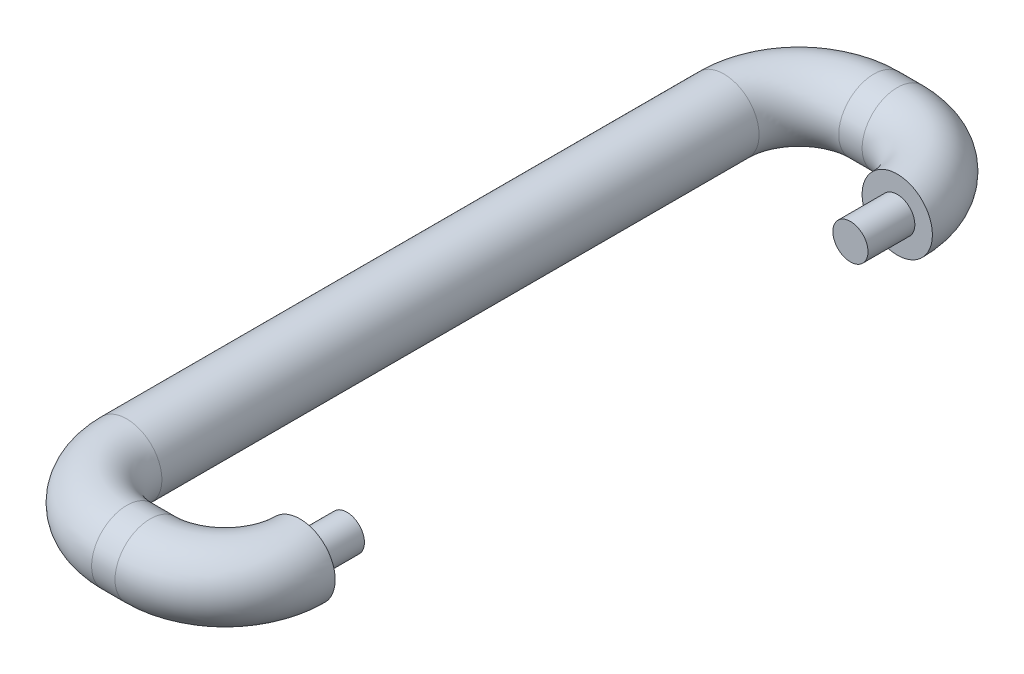
from build123d import *

# Parameters (mm, degrees)
SKETCH_2_R          = 7.5
EXTRUDE_1_DEPTH     = 127.5
SKETCH_3_R          = 7.5
REVOLVE_1_ANGLE     = 90
REVOLVE_2_OUTLINE_R = 7.5
REVOLVE_2_ANGLE     = 90
SKETCH_19_R         = 7.5
EXTRUDE_2_DEPTH     = 5
SKETCH_21_R         = 7.5
EXTRUDE_3_DEPTH     = 5
SKETCH_22_R         = 7.5
REVOLVE_3_ANGLE     = 90
SKETCH_23_R         = 7.5
REVOLVE_4_ANGLE     = 90
SKETCH_25_R         = 3.75
EXTRUDE_4_DEPTH     = 10
EXTRUDE_START       = 10
SKETCH_26_R         = 3.75
EXTRUDE_5_DEPTH     = 10


# Read off the part's stored shape, not the designer's step: Повернуть2
with BuildPart() as part:
    # Эскиз2 → Бобышка-Вытянуть1 (new body)
    with BuildSketch(Plane.XY):
        Circle(SKETCH_2_R)
    extrude(amount=EXTRUDE_1_DEPTH)

    # Эскиз3 → Повернуть1 (revolve)
    with BuildSketch(Plane.XY.offset(127.5)):
        with Locations(Location((0, 0, 0), (0, 0, 180))):
            Circle(SKETCH_3_R)
    revolve(axis=Axis((16, 0, 127.5), (0, 1, 0)), revolution_arc=REVOLVE_1_ANGLE)

    # Повернуть2 outline → Повернуть2 (revolve)
    with BuildSketch(Plane(origin=(16, 0, 0), x_dir=(0, 0, -1), z_dir=(1, 0, 0))):
        with Locations((16, 0)):
            Circle(REVOLVE_2_OUTLINE_R)
    revolve(axis=Axis((16, 0, 0), (0, 1, 0)), revolution_arc=REVOLVE_2_ANGLE)

    # Эскиз19 → Бобышка-Вытянуть2 (add)
    with BuildSketch(Plane(origin=(16, 0, 0), x_dir=(0, 0, -1), z_dir=(1, 0, 0))):
        with Locations((16, 0)):
            Circle(SKETCH_19_R)
    extrude(amount=EXTRUDE_2_DEPTH)

    # Эскиз21 → Бобышка-Вытянуть3 (add)
    with BuildSketch(Plane(origin=(16, 0, 0), x_dir=(0, 0, -1), z_dir=(1, 0, 0))):
        with Locations(Location((-143.5, 0, 0), (0, 0, 180))):
            Circle(SKETCH_21_R)
    extrude(amount=EXTRUDE_3_DEPTH)

    # Эскиз22 → Повернуть3 (revolve)
    with BuildSketch(Plane(origin=(21, 0, 0), x_dir=(0, 0, -1), z_dir=(1, 0, 0))):
        with Locations((16, 0)):
            Circle(SKETCH_22_R)
    revolve(axis=Axis((21, 0, 0), (0, -1, 0)), revolution_arc=REVOLVE_3_ANGLE)

    # Эскиз23 → Повернуть4 (revolve)
    with BuildSketch(Plane(origin=(21, 0, 0), x_dir=(0, 0, -1), z_dir=(1, 0, 0))):
        with Locations(Location((-143.5, 0, 0), (0, 0, 180))):
            Circle(SKETCH_23_R)
    revolve(axis=Axis((21, 0, 127.5), (0, 1, 0)), revolution_arc=REVOLVE_4_ANGLE)

    # Эскиз25 → Бобышка-Вытянуть4 (add)
    with BuildSketch(Plane.XY):
        with Locations((37, 0)):
            Circle(SKETCH_25_R)
    extrude(amount=EXTRUDE_4_DEPTH)

    # Эскиз26 → Бобышка-Вытянуть5 (add)
    with BuildSketch(Plane(origin=(0, 0, 127.5), x_dir=(-1, 0, 0), z_dir=(0, 0, -1)).offset(EXTRUDE_START)):
        with Locations(Location((-37, 0, 0), (0, 0, 180))):
            Circle(SKETCH_26_R)
    extrude(amount=-EXTRUDE_5_DEPTH)


solid = part.part
